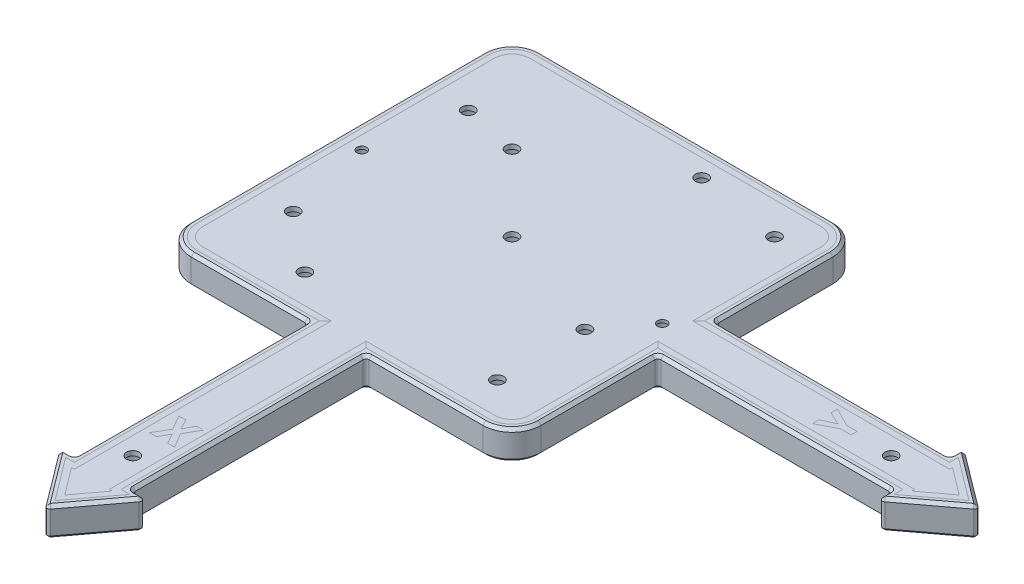
from build123d import *

# Parameters (mm, degrees)
BOSS_EXTRUDE1_DEPTH   = 10
SKETCH2_R             = 2.15
CUT_EXTRUDE1_DEPTH    = 199.242276016
SKETCH3_R             = 1.65
CUT_EXTRUDE2_DEPTH    = 199.242276016
SKETCH4_R             = 5
CUT_EXTRUDE3_DEPTH    = 8.4
SKETCH5_R             = 3
CUT_EXTRUDE4_DEPTH    = 9
FILLET1_R             = 10
BOSS_EXTRUDE2_DEPTH   = 10
CUT_EXTRUDE5_DEPTH    = 1
BOSS_EXTRUDE3_DEPTH   = 1
CUT_EXTRUDE6_DEPTH    = 1
BOSS_EXTRUDE4_DEPTH   = 1
CUT_EXTRUDE7_DEPTH    = 1
BOSS_EXTRUDE5_DEPTH   = 1
BOSS_EXTRUDE5_2_DEPTH = 1
FILLET2_R             = 1
CHAMFER1_SIZE         = 1
CUT_EXTRUDE8_DEPTH    = 1
BOSS_EXTRUDE6_DEPTH   = 1
CUT_EXTRUDE9_DEPTH    = 1
BOSS_EXTRUDE7_DEPTH   = 1


with BuildPart() as part:
    # Sketch1 → Boss-Extrude1 (new body)
    with BuildSketch(Plane(origin=(0, 0, 0), x_dir=(1, 0, 0), z_dir=(0, 1, 0))):
        Polygon((-10, -60), (-10, -140), (10, -140), (10, -60), (60, -60), (60, -10), (140, -10), (140, 10), (60, 10), (60, 60), (-60, 60), (-60, -60), align=None)
    extrude(amount=BOSS_EXTRUDE1_DEPTH)

    # Sketch2 → Cut-Extrude1 (cut, through all)
    with BuildSketch(Plane(origin=(0, 10, 0), x_dir=(1, 0, 0), z_dir=(0, 1, 0))):
        with Locations(Location((0, 0, 0), (0, 0, 270))):
            Circle(SKETCH2_R)
        with Locations(Location((130, 0, 0), (0, 0, 270))):
            Circle(SKETCH2_R)
        with Locations(Location((0, -130, 0), (0, 0, 270))):
            Circle(SKETCH2_R)
        with Locations(Location((40, -45, 0), (0, 0, 270))):
            Circle(SKETCH2_R)
        with Locations(Location((-45, -30, 0), (0, 0, 270))):
            Circle(SKETCH2_R)
        with Locations(Location((-26, 26, 0), (0, 0, 270))):
            Circle(SKETCH2_R)
        with Locations(Location((45, 45, 0), (0, 0, 270))):
            Circle(SKETCH2_R)
        with Locations(Location((15, 50, 0), (0, 0, 270))):
            Circle(SKETCH2_R)
        with Locations(Location((40, -15, 0), (0, 0, 270))):
            Circle(SKETCH2_R)
        with Locations(Location((-25, -46, 0), (0, 0, 270))):
            Circle(SKETCH2_R)
        with Locations(Location((-45, 30, 0), (0, 0, 270))):
            Circle(SKETCH2_R)
    extrude(amount=-CUT_EXTRUDE1_DEPTH, mode=Mode.SUBTRACT)

    # Sketch3 → Cut-Extrude2 (cut, through all)
    with BuildSketch(Plane(origin=(0, 10, 0), x_dir=(1, 0, 0), z_dir=(0, 1, 0))):
        with Locations(Location((51.5, 0, 0), (0, 0, 270))):
            Circle(SKETCH3_R)
        with Locations(Location((-51.5, 0, 0), (0, 0, 270))):
            Circle(SKETCH3_R)
    extrude(amount=-CUT_EXTRUDE2_DEPTH, mode=Mode.SUBTRACT)

    # Sketch4 → Cut-Extrude3 (cut)
    with BuildSketch(Plane.XZ):
        with Locations(Location((-45, 30, 0), (0, 0, 270))):
            Circle(SKETCH4_R)
        with Locations(Location((40, 45, 0), (0, 0, 270))):
            Circle(SKETCH4_R)
        with Locations(Location((0, 130, 0), (0, 0, 270))):
            Circle(SKETCH4_R)
        with Locations(Location((130, 0, 0), (0, 0, 270))):
            Circle(SKETCH4_R)
        with Locations(Location((0, 0, 0), (0, 0, 270))):
            Circle(SKETCH4_R)
        with Locations(Location((-26, -26, 0), (0, 0, 270))):
            Circle(SKETCH4_R)
        with Locations(Location((45, -45, 0), (0, 0, 270))):
            Circle(SKETCH4_R)
        with Locations(Location((40, 15, 0), (0, 0, 270))):
            Circle(SKETCH4_R)
        with Locations(Location((-25, 46, 0), (0, 0, 270))):
            Circle(SKETCH4_R)
        with Locations(Location((-45, -30, 0), (0, 0, 270))):
            Circle(SKETCH4_R)
        with Locations(Location((15, -50, 0), (0, 0, 270))):
            Circle(SKETCH4_R)
    extrude(amount=-CUT_EXTRUDE3_DEPTH, mode=Mode.SUBTRACT)

    # Sketch5 → Cut-Extrude4 (cut)
    with BuildSketch(Plane.XZ):
        with Locations(Location((-51.5, 0, 0), (0, 0, 270))):
            Circle(SKETCH5_R)
        with Locations(Location((51.5, 0, 0), (0, 0, 270))):
            Circle(SKETCH5_R)
    extrude(amount=-CUT_EXTRUDE4_DEPTH, mode=Mode.SUBTRACT)

    # Fillet1
    fillet1_edges = [part.edges().sort_by_distance(p)[0] for p in [
        (60, 5, 60),
        (-60, 5, 60),
        (-60, 5, -60),
        (60, 5, -60),
    ]]
    fillet(fillet1_edges, radius=FILLET1_R)

    # Sketch6 → Boss-Extrude2 (add)
    with BuildSketch(Plane(origin=(0, 10, 0), x_dir=(1, 0, 0), z_dir=(0, 1, 0))):
        Polygon((0, -140), (15, -140), (0, -160), (-15, -140), align=None)
        Polygon((140, 0), (140, -15), (160, 0), (140, 15), align=None)
    extrude(amount=-BOSS_EXTRUDE2_DEPTH)

    # Sketch7 → Cut-Extrude5 (cut)
    with BuildSketch(Plane(origin=(0, 10, 0), x_dir=(1, 0, 0), z_dir=(0, 1, 0))):
        Polygon((6, -144), (6, -56), (8, -58), (8, -142), (11, -142), (0, -156.666666667), (-11, -142), (-8, -142), (-8, -58), (-6, -56), (-6, -144), (-7, -144), (0, -153.333333333), (7, -144), align=None)
    extrude(amount=-CUT_EXTRUDE5_DEPTH, mode=Mode.SUBTRACT)

    # Sketch7<4> → Cut-Extrude6 (cut)
    with BuildSketch(Plane(origin=(0, 10, 0), x_dir=(1, 0, 0), z_dir=(0, 1, 0))):
        Polygon((144, 6), (56, 6), (58, 8), (142, 8), (142, 11), (156.666666667, 0), (142, -11), (142, -8), (58, -8), (56, -6), (144, -6), (144, -7), (153.333333333, 0), (144, 7), align=None)
    extrude(amount=-CUT_EXTRUDE6_DEPTH, mode=Mode.SUBTRACT)

    # Sketch7<6> → Cut-Extrude7 (cut)
    with BuildSketch(Plane(origin=(0, 10, 0), x_dir=(1, 0, 0), z_dir=(0, 1, 0))):
        with BuildLine():
            ThreePointArc((56, 50), (54.242640687, 54.242640687), (50, 56))
            Line((50, 56), (-50, 56))
            ThreePointArc((-50, 56), (-54.242640687, 54.242640687), (-56, 50))
            Line((-56, 50), (-56, -50))
            ThreePointArc((-56, -50), (-54.242640687, -54.242640687), (-50, -56))
            Line((-50, -56), (-6, -56))
            Line((-6, -56), (-8, -58))
            Line((-8, -58), (-50, -58))
            ThreePointArc((-50, -58), (-55.656854249, -55.656854249), (-58, -50))
            Line((-58, -50), (-58, 50))
            ThreePointArc((-58, 50), (-55.656854249, 55.656854249), (-50, 58))
            Line((-50, 58), (50, 58))
            ThreePointArc((50, 58), (55.656854249, 55.656854249), (58, 50))
            Line((58, 50), (58, 8))
            Line((58, 8), (56, 6))
            Line((56, 6), (56, 50))
        make_face()
        with BuildLine():
            ThreePointArc((50, -56), (54.242640687, -54.242640687), (56, -50))
            Line((56, -50), (56, -6))
            Line((56, -6), (58, -8))
            Line((58, -8), (58, -50))
            ThreePointArc((58, -50), (55.656854249, -55.656854249), (50, -58))
            Line((50, -58), (8, -58))
            Line((8, -58), (6, -56))
            Line((6, -56), (50, -56))
        make_face()
    extrude(amount=-CUT_EXTRUDE7_DEPTH, mode=Mode.SUBTRACT)

    # Fillet2
    fillet2_edges = [part.edges().sort_by_distance(p)[0] for p in [
        (0, 5, 160),
        (15, 5, 140),
        (-15, 5, 140),
        (60, 5, -10),
        (140, 5, -10),
        (140, 5, 10),
        (60, 5, 10),
        (10, 5, 60),
        (10, 5, 140),
        (-10, 5, 140),
        (-10, 5, 60),
        (140, 5, 15),
        (160, 5, 0),
        (140, 5, -15),
    ]]
    fillet(fillet2_edges, radius=FILLET2_R)

    # Chamfer1
    chamfer1_edges = [part.edges().sort_by_distance(p)[0] for p in [
        (-60, 0, 0),
        (-60, 10, 0),
        (60, 0, 30.5),
        (-30.5, 0, 60),
        (0, 0, -60),
        (57.071067812, 0, 57.071067812),
        (-57.071067812, 0, 57.071067812),
        (57.071067812, 0, -57.071067812),
        (-57.071067812, 0, -57.071067812),
        (0, 10, -60),
        (-30.5, 10, 60),
        (60, 10, 30.5),
        (57.071067812, 10, 57.071067812),
        (-57.071067812, 10, 57.071067812),
        (57.071067812, 10, -57.071067812),
        (-57.071067812, 10, -57.071067812),
        (60, 0, -30.5),
        (60, 10, -30.5),
        (100, 0, -10),
        (100, 10, -10),
        (-10, 0, 100),
        (-10, 10, 100),
        (30.5, 0, 60),
        (30.5, 10, 60),
        (10, 0, 100),
        (10, 10, 100),
        (100, 0, 10),
        (100, 10, 10),
        (140, 10, 12),
        (140, 0, 12),
        (-12, 10, 140),
        (-7.3, 10, 150.266666667),
        (7.3, 10, 150.266666667),
        (12, 10, 140),
        (150.266666667, 10, 7.3),
        (150.266666667, 10, -7.3),
        (140, 10, -12),
        (13.894427191, 10, 140.552786405),
        (0, 10, 159.333333333),
        (-13.894427191, 10, 140.552786405),
        (159.333333333, 10, 0),
        (140.552786405, 10, -13.894427191),
        (140.552786405, 10, 13.894427191),
        (150.266666667, 0, 7.3),
        (140, 0, -12),
        (150.266666667, 0, -7.3),
        (12, 0, 140),
        (7.3, 0, 150.266666667),
        (-7.3, 0, 150.266666667),
        (-12, 0, 140),
        (13.894427191, 0, 140.552786405),
        (0, 0, 159.333333333),
        (-13.894427191, 0, 140.552786405),
        (159.333333333, 0, 0),
        (140.552786405, 0, -13.894427191),
        (140.552786405, 0, 13.894427191),
        (60.292893219, 0, -10.292893219),
        (60.292893219, 10, -10.292893219),
        (-10.292893219, 0, 60.292893219),
        (-10.292893219, 10, 60.292893219),
        (10.292893219, 0, 60.292893219),
        (10.292893219, 10, 60.292893219),
        (60.292893219, 0, 10.292893219),
        (60.292893219, 10, 10.292893219),
        (139.707106781, 0, 10.292893219),
        (139.707106781, 10, 10.292893219),
        (139.707106781, 0, -10.292893219),
        (139.707106781, 10, -10.292893219),
        (-10.292893219, 0, 139.707106781),
        (-10.292893219, 10, 139.707106781),
        (10.292893219, 0, 139.707106781),
        (10.292893219, 10, 139.707106781),
    ]]
    chamfer(chamfer1_edges, length=CHAMFER1_SIZE - 0.0001)  # a hair under: the kernel refuses the full size

    # Sketch8 → Cut-Extrude8 (cut)
    with BuildSketch(Plane(origin=(0, 10, 0), x_dir=(1, 0, 0), z_dir=(0, 1, 0))):
        Polygon((0.328010799, -113.757586344), (2.198952357, -110.30994024), (4.560965344, -110.30994024), (1.657150409, -115.269355824), (4.636046513, -120.30994024), (2.245624435, -120.30994024), (0.328010799, -116.807505175), (-1.589602838, -120.30994024), (-3.980024916, -120.30994024), (-1.001128812, -115.269355824), (-3.904943747, -110.30994024), (-1.540901539, -110.30994024), align=None)
    extrude(amount=-CUT_EXTRUDE8_DEPTH, mode=Mode.SUBTRACT)

    # Sketch9 → Cut-Extrude9 (cut)
    with BuildSketch(Plane(origin=(0, 10, 0), x_dir=(1, 0, 0), z_dir=(0, 1, 0))):
        Polygon((111.451808288, 0.328327922), (106.946938158, 2.404220779), (106.946938158, 4.650568182), (113.320720626, 1.375405844), (116.946938158, 1.375405844), (116.946938158, -0.712662338), (113.320720626, -0.712662338), (106.946938158, -3.985795455), (106.946938158, -1.73336039), align=None)
    extrude(amount=-CUT_EXTRUDE9_DEPTH, mode=Mode.SUBTRACT)


with BuildPart() as body_2:
    # Sketch7<3> → Boss-Extrude3 (new body)
    with BuildSketch(Plane(origin=(0, 10, 0), x_dir=(1, 0, 0), z_dir=(0, 1, 0))):
        Polygon((6, -144), (6, -56), (8, -58), (8, -142), (11, -142), (0, -156.666666667), (-11, -142), (-8, -142), (-8, -58), (-6, -56), (-6, -144), (-7, -144), (0, -153.333333333), (7, -144), align=None)
    extrude(amount=-BOSS_EXTRUDE3_DEPTH)


with BuildPart() as body_3:
    # Sketch7<5> → Boss-Extrude4 (new body)
    with BuildSketch(Plane(origin=(0, 10, 0), x_dir=(1, 0, 0), z_dir=(0, 1, 0))):
        Polygon((144, 6), (56, 6), (58, 8), (142, 8), (142, 11), (156.666666667, 0), (142, -11), (142, -8), (58, -8), (56, -6), (144, -6), (144, -7), (153.333333333, 0), (144, 7), align=None)
    extrude(amount=-BOSS_EXTRUDE4_DEPTH)


with BuildPart() as body_4:
    # Sketch7<7> → Boss-Extrude5 (new body)
    with BuildSketch(Plane(origin=(0, 10, 0), x_dir=(1, 0, 0), z_dir=(0, 1, 0))):
        with BuildLine():
            ThreePointArc((56, 50), (54.242640687, 54.242640687), (50, 56))
            Line((50, 56), (-50, 56))
            ThreePointArc((-50, 56), (-54.242640687, 54.242640687), (-56, 50))
            Line((-56, 50), (-56, -50))
            ThreePointArc((-56, -50), (-54.242640687, -54.242640687), (-50, -56))
            Line((-50, -56), (-6, -56))
            Line((-6, -56), (-8, -58))
            Line((-8, -58), (-50, -58))
            ThreePointArc((-50, -58), (-55.656854249, -55.656854249), (-58, -50))
            Line((-58, -50), (-58, 50))
            ThreePointArc((-58, 50), (-55.656854249, 55.656854249), (-50, 58))
            Line((-50, 58), (50, 58))
            ThreePointArc((50, 58), (55.656854249, 55.656854249), (58, 50))
            Line((58, 50), (58, 8))
            Line((58, 8), (56, 6))
            Line((56, 6), (56, 50))
        make_face()
    extrude(amount=-BOSS_EXTRUDE5_DEPTH)


with BuildPart() as body_5:
    # Sketch7<7> → Boss-Extrude5 2 (new body)
    with BuildSketch(Plane(origin=(0, 10, 0), x_dir=(1, 0, 0), z_dir=(0, 1, 0))):
        with BuildLine():
            ThreePointArc((50, -56), (54.242640687, -54.242640687), (56, -50))
            Line((56, -50), (56, -6))
            Line((56, -6), (58, -8))
            Line((58, -8), (58, -50))
            ThreePointArc((58, -50), (55.656854249, -55.656854249), (50, -58))
            Line((50, -58), (8, -58))
            Line((8, -58), (6, -56))
            Line((6, -56), (50, -56))
        make_face()
    extrude(amount=-BOSS_EXTRUDE5_2_DEPTH)


with BuildPart() as body_6:
    # Sketch8<2> → Boss-Extrude6 (new body)
    with BuildSketch(Plane(origin=(0, 10, 0), x_dir=(1, 0, 0), z_dir=(0, 1, 0))):
        Polygon((0.328010799, -113.757586344), (2.198952357, -110.30994024), (4.560965344, -110.30994024), (1.657150409, -115.269355824), (4.636046513, -120.30994024), (2.245624435, -120.30994024), (0.328010799, -116.807505175), (-1.589602838, -120.30994024), (-3.980024916, -120.30994024), (-1.001128812, -115.269355824), (-3.904943747, -110.30994024), (-1.540901539, -110.30994024), align=None)
    extrude(amount=-BOSS_EXTRUDE6_DEPTH)


with BuildPart() as body_7:
    # Sketch9<2> → Boss-Extrude7 (new body)
    with BuildSketch(Plane(origin=(0, 10, 0), x_dir=(1, 0, 0), z_dir=(0, 1, 0))):
        Polygon((111.451808288, 0.328327922), (106.946938158, 2.404220779), (106.946938158, 4.650568182), (113.320720626, 1.375405844), (116.946938158, 1.375405844), (116.946938158, -0.712662338), (113.320720626, -0.712662338), (106.946938158, -3.985795455), (106.946938158, -1.73336039), align=None)
    extrude(amount=-BOSS_EXTRUDE7_DEPTH)


solid = Compound([part.part, body_2.part, body_3.part, body_4.part, body_5.part, body_6.part, body_7.part])
